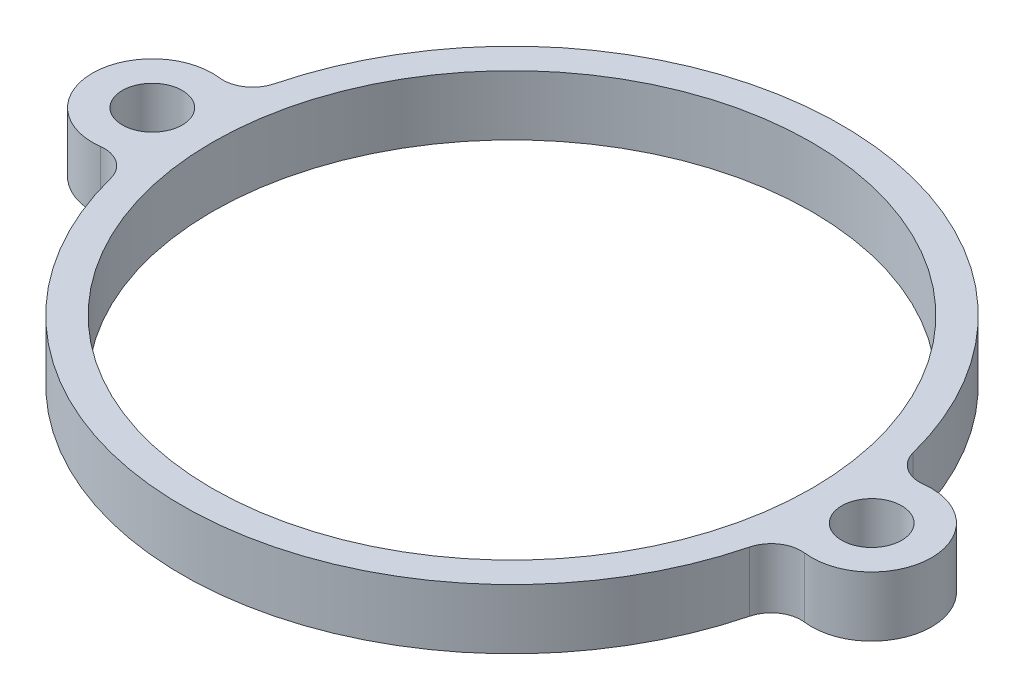
from build123d import *

# Parameters (mm, degrees)
SKETCH1_R           = 50
SKETCH1_R_2         = 5
BOSS_EXTRUDE1_DEPTH = 10


with BuildPart() as part:
    # Sketch1 → Boss-Extrude1 (new body)
    with BuildSketch(Plane(origin=(0, 0, 0), x_dir=(1, 0, 0), z_dir=(0, 1, 0))):
        with BuildLine():
            ThreePointArc((-53.28125, -13.642155198), (0, -55), (53.28125, -13.642155198))
            ThreePointArc((53.28125, -13.642155198), (55.3125, -10.748364701), (58.75, -9.921567416))
            ThreePointArc((58.75, -9.921567416), (70, 0), (58.75, 9.921567416))
            ThreePointArc((58.75, 9.921567416), (55.3125, 10.748364701), (53.28125, 13.642155198))
            ThreePointArc((53.28125, 13.642155198), (0, 55), (-53.28125, 13.642155198))
            ThreePointArc((-53.28125, 13.642155198), (-55.3125, 10.748364701), (-58.75, 9.921567416))
            ThreePointArc((-58.75, 9.921567416), (-70, 0), (-58.75, -9.921567416))
            ThreePointArc((-58.75, -9.921567416), (-55.3125, -10.748364701), (-53.28125, -13.642155198))
        make_face()
        Circle(SKETCH1_R, mode=Mode.SUBTRACT)
        with Locations((-60, 0)):
            Circle(SKETCH1_R_2, mode=Mode.SUBTRACT)
        with Locations((60, 0)):
            Circle(SKETCH1_R_2, mode=Mode.SUBTRACT)
    extrude(amount=BOSS_EXTRUDE1_DEPTH)


solid = part.part
